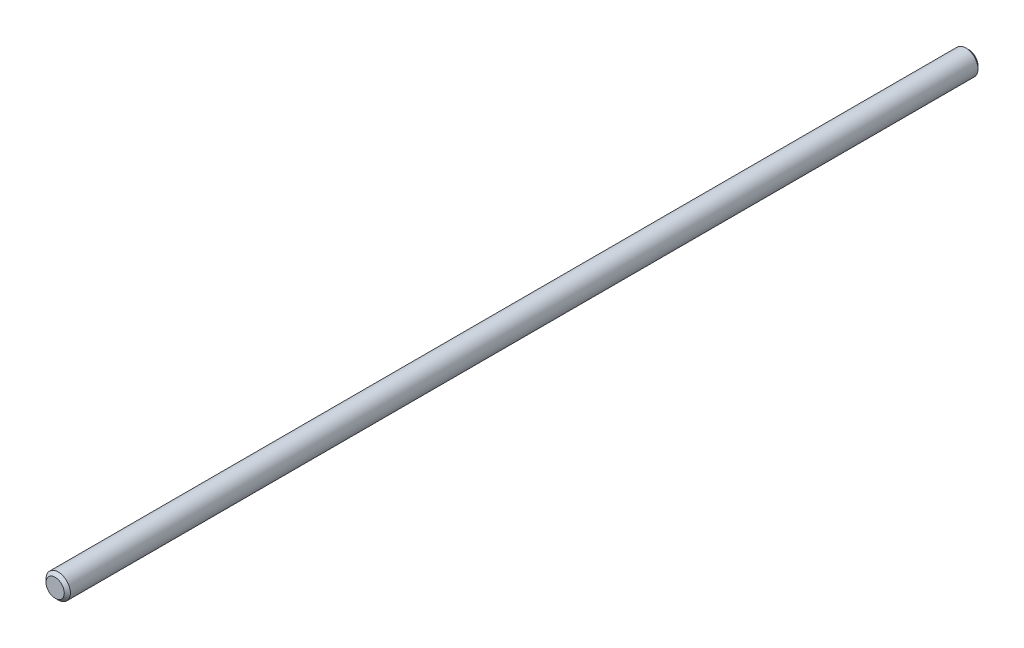
from build123d import *

# Parameters (mm, degrees)
SKETCH_1_R      = 2
EXTRUDE_1_DEPTH = 150
CHAMFER_1_SIZE  = 0.5


with BuildPart() as part:
    # 草图1 → 凸台-拉伸1 (new body)
    with BuildSketch(Plane.XY):
        Circle(SKETCH_1_R)
    extrude(amount=-EXTRUDE_1_DEPTH)

    # 倒角1
    chamfer_1_edges = [part.edges().sort_by_distance(p)[0] for p in [
        (-2, 0, -150),
        (-2, 0, 0),
    ]]
    chamfer(chamfer_1_edges, length=CHAMFER_1_SIZE)


solid = part.part
